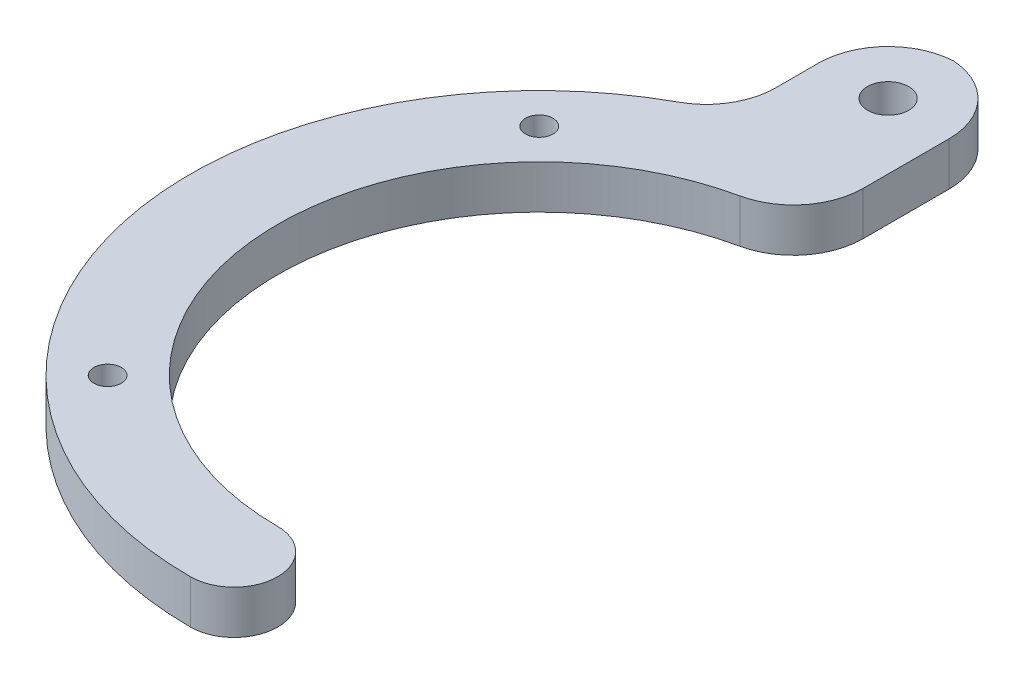
from build123d import *

# Parameters (mm, degrees)
SKETCH1_R           = 3
SKETCH1_R_2         = 2
BOSS_EXTRUDE1_DEPTH = 6.35
FILLET1_R           = 10.16


with BuildPart() as part:
    # Sketch1 → Boss-Extrude1 (new body)
    with BuildSketch(Plane(origin=(0, 0, 0), x_dir=(1, 0, 0), z_dir=(0, 1, 0))):
        with BuildLine():
            Line((19.05, 0), (0, 0))
            Line((0, 0), (0, -22.757139607))
            ThreePointArc((0, -22.757139607), (-30.814603217, -79.553676933), (19.05, -120.65))
            ThreePointArc((19.05, -120.65), (25.4, -114.3), (19.05, -107.95))
            ThreePointArc((19.05, -107.95), (-19.05, -69.85), (19.05, -31.75))
            Line((19.05, -31.75), (19.05, 0))
        make_face()
        with Locations(Location((9.525, -9.525, 0), (0, 0, 270))):
            Circle(SKETCH1_R, mode=Mode.SUBTRACT)
        with Locations(Location((-12.380896424, -38.419103576, 0), (0, 0, 270))):
            Circle(SKETCH1_R_2, mode=Mode.SUBTRACT)
        with Locations(Location((-12.380896424, -101.280896424, 0), (0, 0, 270))):
            Circle(SKETCH1_R_2, mode=Mode.SUBTRACT)
    extrude(amount=BOSS_EXTRUDE1_DEPTH)

    # Fillet1
    # the kernel refuses this fillet: 10.16 mm, written as the material it adds along each edge
    with BuildSketch(Plane(origin=(0, 0, 22.757139607), x_dir=(0, 0, -1), z_dir=(0, 1, 0))) as fillet1_piece_1:
        with BuildLine():
            CenterArc((6.413190667, 10.16), FILLET1_R, 208.630989837, 61.369010163)
            ThreePointArc((-2.50448451, 5.291666667), (-1.175949507, 2.681941807), (0, 0))
            Line((0, 0), (6.413190667, 0))
        make_face()
    extrude(amount=6.35)
    # the kernel refuses this fillet: 10.16 mm, written as the material it takes off along each edge
    with BuildSketch(Plane(origin=(19.05, -22.696015193, 31.75), x_dir=(0, 0, -1), z_dir=(0, 1, 0))) as fillet1_2_piece_1:
        with BuildLine():
            CenterArc((9.078406077, 10.16), FILLET1_R, 192.153197469, 77.846802531)
            ThreePointArc((-0.853889939, 8.021052632), (-0.214073897, 4.033187739), (0, 0))
            Line((0, 0), (9.078406077, 0))
        make_face()
    extrude(amount=51.742030387, mode=Mode.SUBTRACT)
    with BuildSketch(Plane(origin=(0, -25.4, 0), x_dir=(1, 0, 0), z_dir=(0, 1, 0)), Plane(origin=(19.05, -25.4, 0), x_dir=(0, 0, 1), z_dir=(0, 1, 0))) as fillet1_2_piece_2:
        with BuildLine():
            CenterArc((FILLET1_R, -FILLET1_R), FILLET1_R, 90, 90)
            Line((0, -FILLET1_R), (0, 0))
            Line((0, 0), (FILLET1_R, 0))
        make_face()
    extrude(amount=57.15, mode=Mode.SUBTRACT)


solid = part.part
